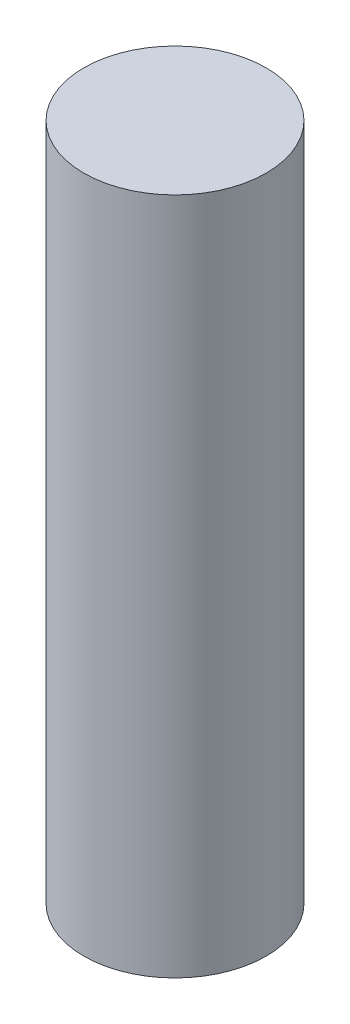
from build123d import *

# Parameters (mm, degrees)
SKETCH1_R           = 2.475
BOSS_EXTRUDE1_DEPTH = 18.4


with BuildPart() as part:
    # Sketch1 → Boss-Extrude1 (new body)
    with BuildSketch(Plane(origin=(0, 0, 0), x_dir=(1, 0, 0), z_dir=(0, 1, 0))):
        Circle(SKETCH1_R)
    extrude(amount=BOSS_EXTRUDE1_DEPTH)


solid = part.part
